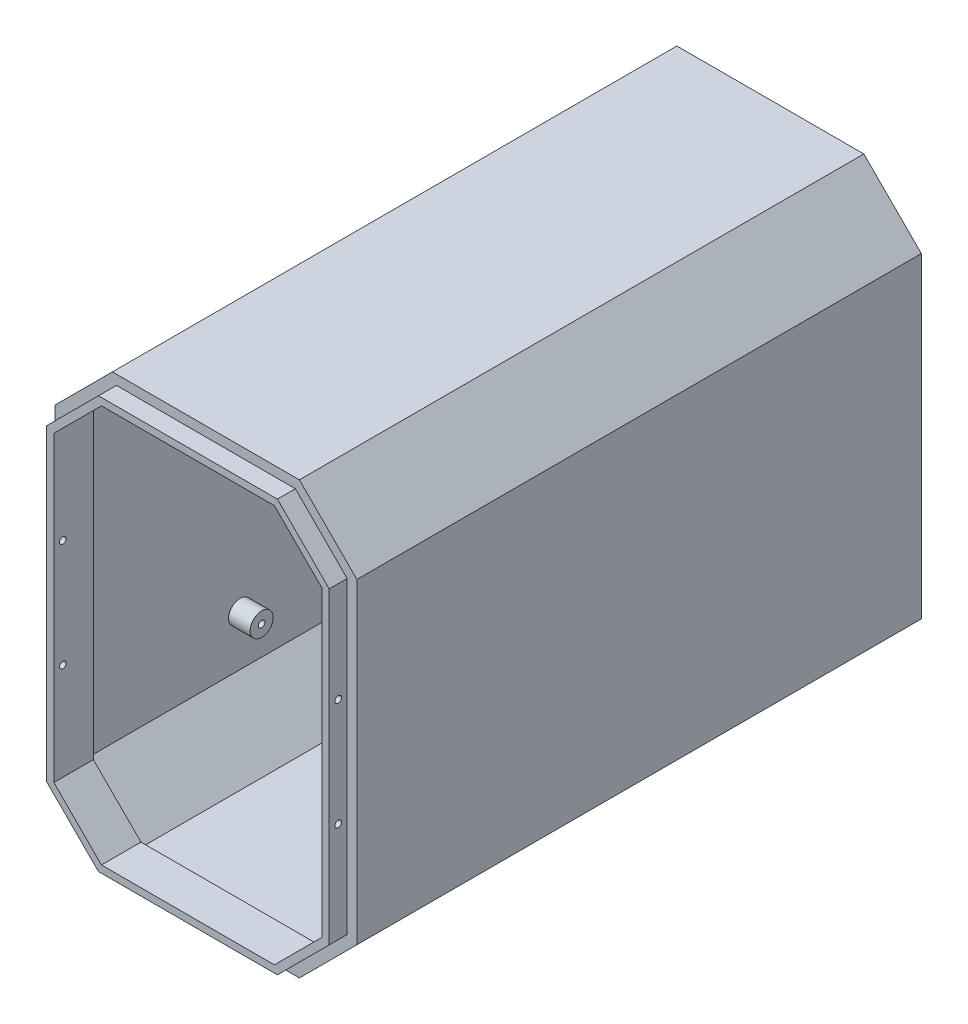
from build123d import *

# Parameters (mm, degrees)
BOSS_1_DEPTH   = 157
CUT_2_DEPTH    = 122.675
CUT_3_DEPTH    = 32.025
S_CUT4_W       = 8
S_CUT4_H       = 28
POCKET_4_DEPTH = 2.7
S_HOLE5_R      = 6
HOLE_5_DEPTH   = 2.7
S_CUT6_W       = 19.4
S_CUT6_H       = 6.3
POCKET_6_DEPTH = 2.7
S_CUT7_W       = 19.4
S_CUT7_H       = 6.3
POCKET_7_DEPTH = 2.7
S_HOLE8_R      = 1.7
HOLE_8_DEPTH   = 2.7
S_HOLE9_R      = 1.7
HOLE_9_DEPTH   = 2.7
S_HOLE10_R     = 1.7
HOLE_10_DEPTH  = 2.7
S_HOLE11_R     = 1.7
HOLE_11_DEPTH  = 2.7
BOSS_12_DEPTH  = 6
BOSS_13_DEPTH  = 5.1
S_CYL14_R      = 3.2
BOSS_14_DEPTH  = 6.5
S_CYL15_R      = 3.2
BOSS_15_DEPTH  = 6.5
S_CYL16_R      = 3.2
BOSS_16_DEPTH  = 6.5
S_CYL17_R      = 3.2
BOSS_17_DEPTH  = 6.5
CUT_18_DEPTH   = 11.2
S_HOLE19_R     = 0.9
HOLE_19_DEPTH  = 2.7
S_HOLE20_R     = 0.9
HOLE_20_DEPTH  = 2.7
S_HOLE21_R     = 0.9
HOLE_21_DEPTH  = 2.7
S_HOLE22_R     = 0.9
HOLE_22_DEPTH  = 2.7
S_HOLE23_R     = 0.9
HOLE_23_DEPTH  = 7.2
S_HOLE24_R     = 0.9
HOLE_24_DEPTH  = 7.2
S_HOLE25_R     = 0.9
HOLE_25_DEPTH  = 7.2
S_HOLE26_R     = 0.9
HOLE_26_DEPTH  = 7.2


with BuildPart() as part:
    # S_prism1 → Boss_1 (new body)
    with BuildSketch(Plane.XY.offset(37)):
        Polygon((42, -44), (42, 44), (26, 60), (-26, 60), (-42, 44), (-42, -44), (-26, -60), (26, -60), align=None)
    extrude(amount=BOSS_1_DEPTH)

    # S_pcut2 → Cut_2 (cut)
    with BuildSketch(Plane.XY.offset(71.425)):
        Polygon((39.5, -42.964466094), (39.5, 42.964466094), (24.964466094, 57.5), (-24.964466094, 57.5), (-39.5, 42.964466094), (-39.5, -42.964466094), (-24.964466094, -57.5), (24.964466094, -57.5), align=None)
    extrude(amount=CUT_2_DEPTH, mode=Mode.SUBTRACT)

    # S_pcut3 → Cut_3 (cut)
    with BuildSketch(Plane.XY.offset(36.9)):
        Polygon((39.5, -42.964466094), (39.5, 42.964466094), (24.964466094, 57.5), (-24.964466094, 57.5), (-39.5, 42.964466094), (-39.5, -42.964466094), (-24.964466094, -57.5), (24.964466094, -57.5), align=None)
    extrude(amount=CUT_3_DEPTH, mode=Mode.SUBTRACT)

    # S_cut4 → Pocket_4 (cut)
    with BuildSketch(Plane.XY.offset(68.825)):
        with Locations((-30, 0)):
            Rectangle(S_CUT4_W, S_CUT4_H)
    extrude(amount=POCKET_4_DEPTH, mode=Mode.SUBTRACT)

    # S_hole5 → Hole_5 (cut)
    with BuildSketch(Plane(origin=(-42.1, 0, 0), x_dir=(0, 0, -1), z_dir=(1, 0, 0))):
        with Locations((-88, 0)):
            Circle(S_HOLE5_R)
    extrude(amount=HOLE_5_DEPTH, mode=Mode.SUBTRACT)

    # S_cut6 → Pocket_6 (cut)
    with BuildSketch(Plane.XY.offset(68.825)):
        with Locations((0, 30.95)):
            Rectangle(S_CUT6_W, S_CUT6_H)
    extrude(amount=POCKET_6_DEPTH, mode=Mode.SUBTRACT)

    # S_cut7 → Pocket_7 (cut)
    with BuildSketch(Plane.XY.offset(68.825)):
        with Locations((0, -30.95)):
            Rectangle(S_CUT7_W, S_CUT7_H)
    extrude(amount=POCKET_7_DEPTH, mode=Mode.SUBTRACT)

    # S_hole8 → Hole_8 (cut)
    with BuildSketch(Plane.XY.offset(68.825)):
        with Locations((-20, -25)):
            Circle(S_HOLE8_R)
    extrude(amount=HOLE_8_DEPTH, mode=Mode.SUBTRACT)

    # S_hole9 → Hole_9 (cut)
    with BuildSketch(Plane.XY.offset(68.825)):
        with Locations((-20, 25)):
            Circle(S_HOLE9_R)
    extrude(amount=HOLE_9_DEPTH, mode=Mode.SUBTRACT)

    # S_hole10 → Hole_10 (cut)
    with BuildSketch(Plane.XY.offset(68.825)):
        with Locations((24, -25)):
            Circle(S_HOLE10_R)
    extrude(amount=HOLE_10_DEPTH, mode=Mode.SUBTRACT)

    # S_hole11 → Hole_11 (cut)
    with BuildSketch(Plane.XY.offset(68.825)):
        with Locations((24, 25)):
            Circle(S_HOLE11_R)
    extrude(amount=HOLE_11_DEPTH, mode=Mode.SUBTRACT)

    # S_prism12 → Boss_12 (add)
    with BuildSketch(Plane.XY.offset(188)):
        Polygon((40, -43.171572875), (40, 43.171572875), (25.171572875, 58), (-25.171572875, 58), (-40, 43.171572875), (-40, -43.171572875), (-25.171572875, -58), (25.171572875, -58), align=None)
    extrude(amount=BOSS_12_DEPTH)

    # S_prism13 → Boss_13 (add)
    with BuildSketch(Plane.XY.offset(193.9)):
        Polygon((39.3, -42.881623382), (39.3, 42.881623382), (24.881623382, 57.3), (-24.881623382, 57.3), (-39.3, 42.881623382), (-39.3, -42.881623382), (-24.881623382, -57.3), (24.881623382, -57.3), align=None)
    extrude(amount=BOSS_13_DEPTH)

    # S_cyl14 → Boss_14 (add)
    with BuildSketch(Plane(origin=(-40, 0, 0), x_dir=(0, 0, -1), z_dir=(1, 0, 0))):
        with Locations((-96, -29)):
            Circle(S_CYL14_R)
    extrude(amount=BOSS_14_DEPTH)

    # S_cyl15 → Boss_15 (add)
    with BuildSketch(Plane(origin=(-40, 0, 0), x_dir=(0, 0, -1), z_dir=(1, 0, 0))):
        with Locations((-145, -29)):
            Circle(S_CYL15_R)
    extrude(amount=BOSS_15_DEPTH)

    # S_cyl16 → Boss_16 (add)
    with BuildSketch(Plane(origin=(-40, 0, 0), x_dir=(0, 0, -1), z_dir=(1, 0, 0))):
        with Locations((-96, 29)):
            Circle(S_CYL16_R)
    extrude(amount=BOSS_16_DEPTH)

    # S_cyl17 → Boss_17 (add)
    with BuildSketch(Plane(origin=(-40, 0, 0), x_dir=(0, 0, -1), z_dir=(1, 0, 0))):
        with Locations((-145, 29)):
            Circle(S_CYL17_R)
    extrude(amount=BOSS_17_DEPTH)

    # S_pcut18 → Cut_18 (cut)
    with BuildSketch(Plane.XY.offset(187.9)):
        Polygon((37.3, -42.053196257), (37.3, 42.053196257), (24.053196257, 55.3), (-24.053196257, 55.3), (-37.3, 42.053196257), (-37.3, -42.053196257), (-24.053196257, -55.3), (24.053196257, -55.3), align=None)
    extrude(amount=CUT_18_DEPTH, mode=Mode.SUBTRACT)

    # S_hole19 → Hole_19 (cut)
    with BuildSketch(Plane(origin=(37.1, 0, 0), x_dir=(0, 0, -1), z_dir=(1, 0, 0))):
        with Locations((-196.5, -15)):
            Circle(S_HOLE19_R)
    extrude(amount=HOLE_19_DEPTH, mode=Mode.SUBTRACT)

    # S_hole20 → Hole_20 (cut)
    with BuildSketch(Plane(origin=(37.1, 0, 0), x_dir=(0, 0, -1), z_dir=(1, 0, 0))):
        with Locations((-196.5, 15)):
            Circle(S_HOLE20_R)
    extrude(amount=HOLE_20_DEPTH, mode=Mode.SUBTRACT)

    # S_hole21 → Hole_21 (cut)
    with BuildSketch(Plane(origin=(-39.8, 0, 0), x_dir=(0, 0, -1), z_dir=(1, 0, 0))):
        with Locations((-196.5, -15)):
            Circle(S_HOLE21_R)
    extrude(amount=HOLE_21_DEPTH, mode=Mode.SUBTRACT)

    # S_hole22 → Hole_22 (cut)
    with BuildSketch(Plane(origin=(-39.8, 0, 0), x_dir=(0, 0, -1), z_dir=(1, 0, 0))):
        with Locations((-196.5, 15)):
            Circle(S_HOLE22_R)
    extrude(amount=HOLE_22_DEPTH, mode=Mode.SUBTRACT)

    # S_hole23 → Hole_23 (cut)
    with BuildSketch(Plane(origin=(-40.6, 0, 0), x_dir=(0, 0, -1), z_dir=(1, 0, 0))):
        with Locations((-96, -29)):
            Circle(S_HOLE23_R)
    extrude(amount=HOLE_23_DEPTH, mode=Mode.SUBTRACT)

    # S_hole24 → Hole_24 (cut)
    with BuildSketch(Plane(origin=(-40.6, 0, 0), x_dir=(0, 0, -1), z_dir=(1, 0, 0))):
        with Locations((-145, -29)):
            Circle(S_HOLE24_R)
    extrude(amount=HOLE_24_DEPTH, mode=Mode.SUBTRACT)

    # S_hole25 → Hole_25 (cut)
    with BuildSketch(Plane(origin=(-40.6, 0, 0), x_dir=(0, 0, -1), z_dir=(1, 0, 0))):
        with Locations((-96, 29)):
            Circle(S_HOLE25_R)
    extrude(amount=HOLE_25_DEPTH, mode=Mode.SUBTRACT)

    # S_hole26 → Hole_26 (cut)
    with BuildSketch(Plane(origin=(-40.6, 0, 0), x_dir=(0, 0, -1), z_dir=(1, 0, 0))):
        with Locations((-145, 29)):
            Circle(S_HOLE26_R)
    extrude(amount=HOLE_26_DEPTH, mode=Mode.SUBTRACT)


solid = part.part
